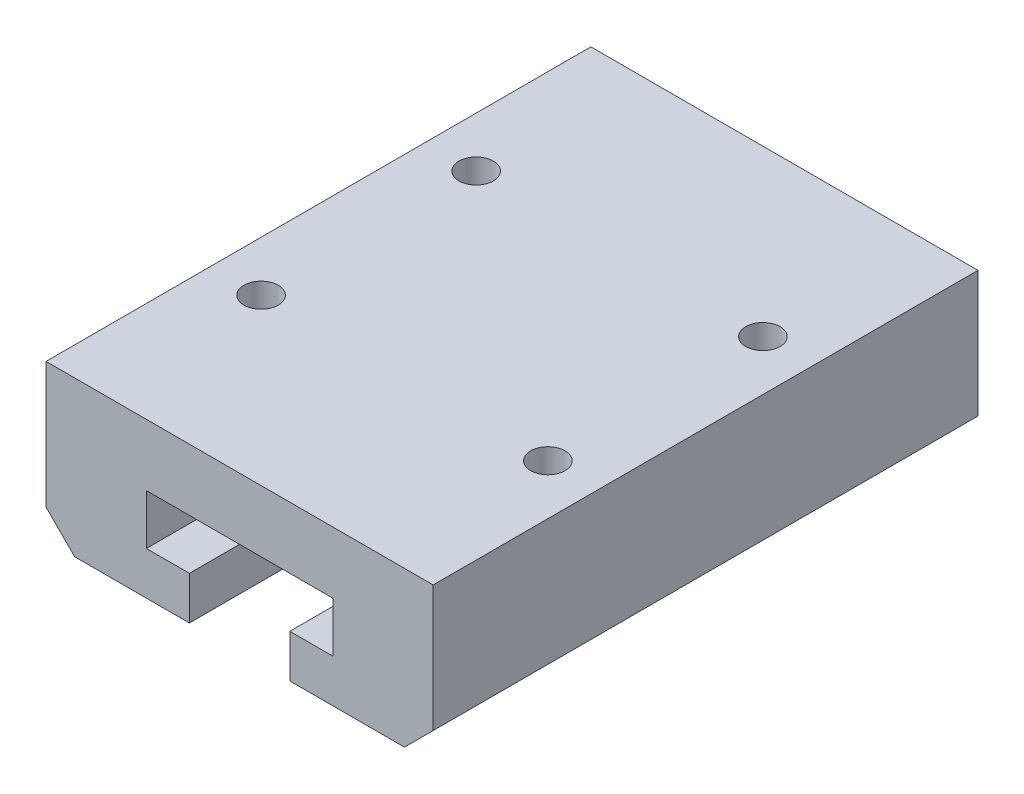
from build123d import *

# Parameters (mm, degrees)
AUFSATZ_LINEAR_AUSTRAGEN1_DEPTH                      = 19
AUFSATZ_LINEAR_AUSTRAGEN1_DEPTH_BACK                 = 19
STIRNSENKUNG_F_R_M2_FLACHKOPFSCHRAUBE_MI_D           = 2.4
STIRNSENKUNG_F_R_M2_FLACHKOPFSCHRAUBE_MI_CBORE_D     = 5
STIRNSENKUNG_F_R_M2_FLACHKOPFSCHRAUBE_MI_CBORE_DEPTH = 1.6
FASE1_SIZE                                           = 2


with BuildPart() as part:
    # Skizze1 → Aufsatz-Linear austragen1 (new, two sides: drawn at the far end of the back side and taken through both)
    with BuildSketch(Plane.XY.offset(-AUFSATZ_LINEAR_AUSTRAGEN1_DEPTH_BACK)):
        Polygon((-3.5, 0), (-3.5, 3), (-6.5, 3), (-6.5, 6.5), (6.5, 6.5), (6.5, 3), (3.5, 3), (3.5, 0), (13.5, 0), (13.5, 10.8), (-13.5, 10.8), (-13.5, 0), align=None)
    extrude(amount=AUFSATZ_LINEAR_AUSTRAGEN1_DEPTH + AUFSATZ_LINEAR_AUSTRAGEN1_DEPTH_BACK)

    # Stirnsenkung für M2 Flachkopfschraube mit Schlitz1 (through all)
    with Locations(Plane(origin=(0, 0, 0), x_dir=(-1, 0, 0), z_dir=(0, -1, 0))):
        with Locations((-10, -7.5), (-10, 7.5), (10, -7.5), (10, 7.5)):
            CounterBoreHole(STIRNSENKUNG_F_R_M2_FLACHKOPFSCHRAUBE_MI_D / 2, STIRNSENKUNG_F_R_M2_FLACHKOPFSCHRAUBE_MI_CBORE_D / 2, STIRNSENKUNG_F_R_M2_FLACHKOPFSCHRAUBE_MI_CBORE_DEPTH)

    # Fase1
    # the kernel refuses this chamfer: 2 mm, written as the material it takes off along each edge
    with BuildSketch(Plane(origin=(-13.5, 0, 24.143365976), x_dir=(0.9996219169112968, -0.027495876610586598, 0), z_dir=(0, 0, -1)), Plane(origin=(13.5, 0, -24.143365976), x_dir=(-0.9996219169112968, -0.027495876610586608, 0), z_dir=(0, 0, 1))) as fase1_piece_1:
        Polygon((FASE1_SIZE * 0.999621916911, -FASE1_SIZE * 0.0274958766106), (-FASE1_SIZE * 0.0274958766106, -FASE1_SIZE * 0.999621916911), (0, 0), align=None)
    extrude(amount=48.286731952, mode=Mode.SUBTRACT)


solid = part.part
